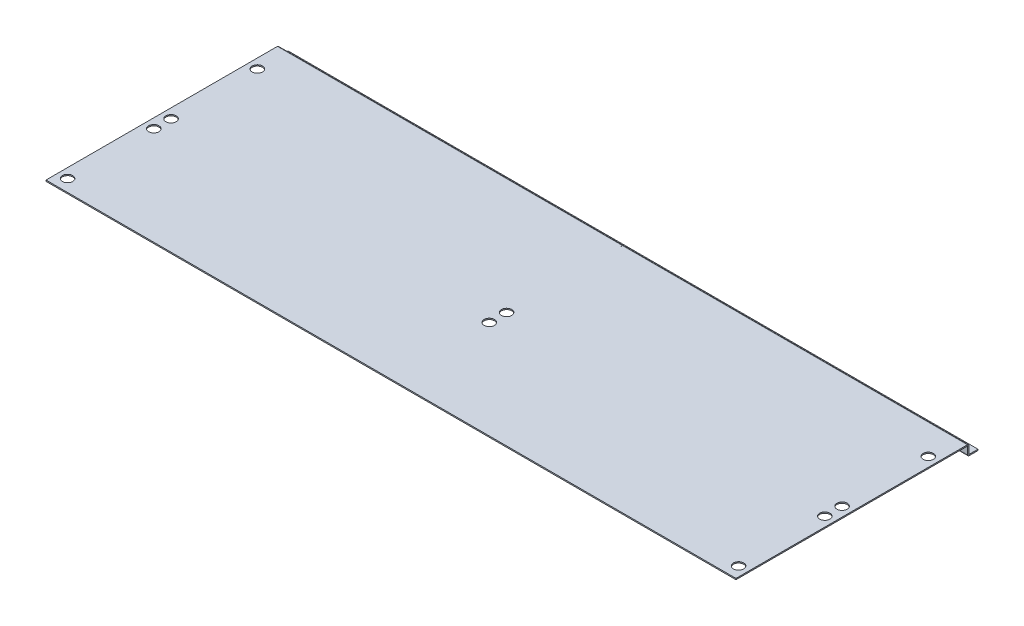
from build123d import *

# Parameters (mm, degrees)
SKETCH_1_W                       = 400
SKETCH_1_H                       = 135
SKETCH_1_R                       = 3
SM_BASE_FLANGE_1_DEPTH           = 0.7
SM_EDGE_FLANGE_1_STRIP_W         = 3.2
SM_EDGE_FLANGE_1_STRIP_H         = 0.7
SM_EDGE_FLANGE_1_STRIP_CUT_DEPTH = 400
SM_EDGE_FLANGE_1_DEPTH           = 400
SM_EDGE_FLANGE_2_STRIP_W         = 3.2
SM_EDGE_FLANGE_2_STRIP_H         = 0.7
SM_EDGE_FLANGE_2_STRIP_CUT_DEPTH = 400
SM_EDGE_FLANGE_2_DEPTH           = 400


# Sheet-metal steps are written as plain solids
with BuildPart() as part:
    # Sketch 1 → 基体-法兰1 (new body)
    with BuildSketch(Plane(origin=(0, 0, 0), x_dir=(1, 0, 0), z_dir=(0, 1, 0))):
        Rectangle(SKETCH_1_W, SKETCH_1_H)
        with Locations(Location((-194.5, -60.5, 0), (0, 0, 270))):
            Circle(SKETCH_1_R, mode=Mode.SUBTRACT)
        with Locations(Location((-194.5, -10.5, 0), (0, 0, 270))):
            Circle(SKETCH_1_R, mode=Mode.SUBTRACT)
        with Locations(Location((-194.5, -0.5, 0), (0, 0, 270))):
            Circle(SKETCH_1_R, mode=Mode.SUBTRACT)
        with Locations(Location((-194.5, 49.5, 0), (0, 0, 270))):
            Circle(SKETCH_1_R, mode=Mode.SUBTRACT)
        with Locations(Location((0, -10.5, 0), (0, 0, 270))):
            Circle(SKETCH_1_R, mode=Mode.SUBTRACT)
        with Locations(Location((0, -0.5, 0), (0, 0, 270))):
            Circle(SKETCH_1_R, mode=Mode.SUBTRACT)
        with Locations(Location((194.5, -60.5, 0), (0, 0, 90))):
            Circle(SKETCH_1_R, mode=Mode.SUBTRACT)
        with Locations(Location((194.5, -10.5, 0), (0, 0, 90))):
            Circle(SKETCH_1_R, mode=Mode.SUBTRACT)
        with Locations(Location((194.5, -0.5, 0), (0, 0, 90))):
            Circle(SKETCH_1_R, mode=Mode.SUBTRACT)
        with Locations(Location((194.5, 49.5, 0), (0, 0, 90))):
            Circle(SKETCH_1_R, mode=Mode.SUBTRACT)
    extrude(amount=-SM_BASE_FLANGE_1_DEPTH)

    # 边线-法兰1 strip (across the edge) → 边线-法兰1 strip cut (cut)
    with BuildSketch(Plane(origin=(-200, -0.7, -67.5), x_dir=(0, 0, 1), z_dir=(1, 0, 0))):
        with Locations((-0.7, -0.35)):
            Rectangle(SM_EDGE_FLANGE_1_STRIP_W, SM_EDGE_FLANGE_1_STRIP_H)
    extrude(amount=SM_EDGE_FLANGE_1_STRIP_CUT_DEPTH, mode=Mode.SUBTRACT)

    # 边线-法兰1 section (across the edge) → 边线-法兰1 (add)
    with BuildSketch(Plane(origin=(-200, -0.7, -67.5), x_dir=(0, 0, 1), z_dir=(1, 0, 0))):
        with BuildLine():
            Line((0, 0.2), (0, 5.3))
            Line((0, 5.3), (0.7, 5.3))
            Line((0.7, 5.3), (0.7, 0.2))
            ThreePointArc((0.7, 0.2), (0.758578644, 0.058578644), (0.9, 0))
            Line((0.9, 0), (0.9, -0.7))
            ThreePointArc((0.9, -0.7), (0.263603897, -0.436396103), (0, 0.2))
        make_face()
    extrude(amount=SM_EDGE_FLANGE_1_DEPTH)

    # 边线-法兰2 strip (across the edge) → 边线-法兰2 strip cut (cut)
    with BuildSketch(Plane(origin=(200, -6, -67.5), x_dir=(0, 1, 0), z_dir=(-1, 0, 0))):
        with Locations((-0.7, -0.35)):
            Rectangle(SM_EDGE_FLANGE_2_STRIP_W, SM_EDGE_FLANGE_2_STRIP_H)
    extrude(amount=SM_EDGE_FLANGE_2_STRIP_CUT_DEPTH, mode=Mode.SUBTRACT)

    # 边线-法兰2 section (across the edge) → 边线-法兰2 (add)
    with BuildSketch(Plane(origin=(200, -6, -67.5), x_dir=(0, 1, 0), z_dir=(-1, 0, 0))):
        with BuildLine():
            Line((0, 0.2), (0, 5.3))
            Line((0, 5.3), (0.7, 5.3))
            Line((0.7, 5.3), (0.7, 0.2))
            ThreePointArc((0.7, 0.2), (0.758578644, 0.058578644), (0.9, 0))
            Line((0.9, 0), (0.9, -0.7))
            ThreePointArc((0.9, -0.7), (0.263603897, -0.436396103), (0, 0.2))
        make_face()
    extrude(amount=SM_EDGE_FLANGE_2_DEPTH)


solid = part.part
